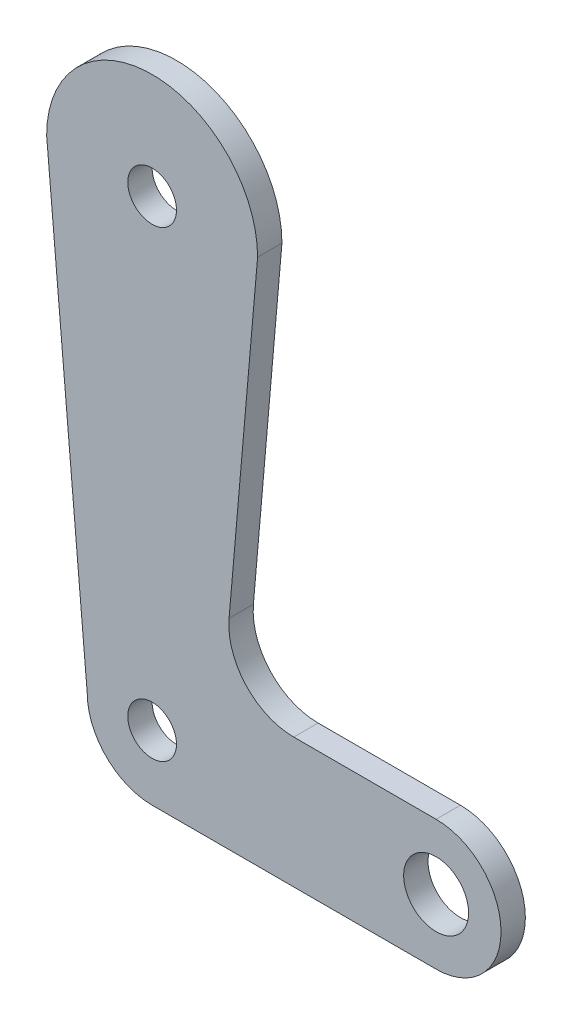
from build123d import *

# Parameters (mm, degrees)
SCHIZZO1_R          = 4
SCHIZZO1_R_2        = 3
BASE_FLANGIA3_DEPTH = 3


# Sheet-metal steps are written as plain solids
with BuildPart() as part:
    # Schizzo1 → Base-Flangia3 (new body)
    with BuildSketch(Plane.XY):
        with BuildLine():
            Line((35, -8), (0, -8))
            ThreePointArc((0, -8), (-5.656854249, -5.656854249), (-8, 0))
            Line((-8, 0), (-13, 57))
            ThreePointArc((-13, 57), (0, 70), (13, 57))
            Line((13, 57), (9.483101588, 16.695421866))
            ThreePointArc((9.483101588, 16.695421866), (11.555218404, 10.594603388), (17.452818548, 8))
            Line((17.452818548, 8), (35, 8))
            ThreePointArc((35, 8), (43, 0), (35, -8))
        make_face()
        with Locations((35, 0)):
            Circle(SCHIZZO1_R, mode=Mode.SUBTRACT)
        Circle(SCHIZZO1_R_2, mode=Mode.SUBTRACT)
        with Locations((0, 57)):
            Circle(SCHIZZO1_R_2, mode=Mode.SUBTRACT)
    extrude(amount=-BASE_FLANGIA3_DEPTH)


solid = part.part
